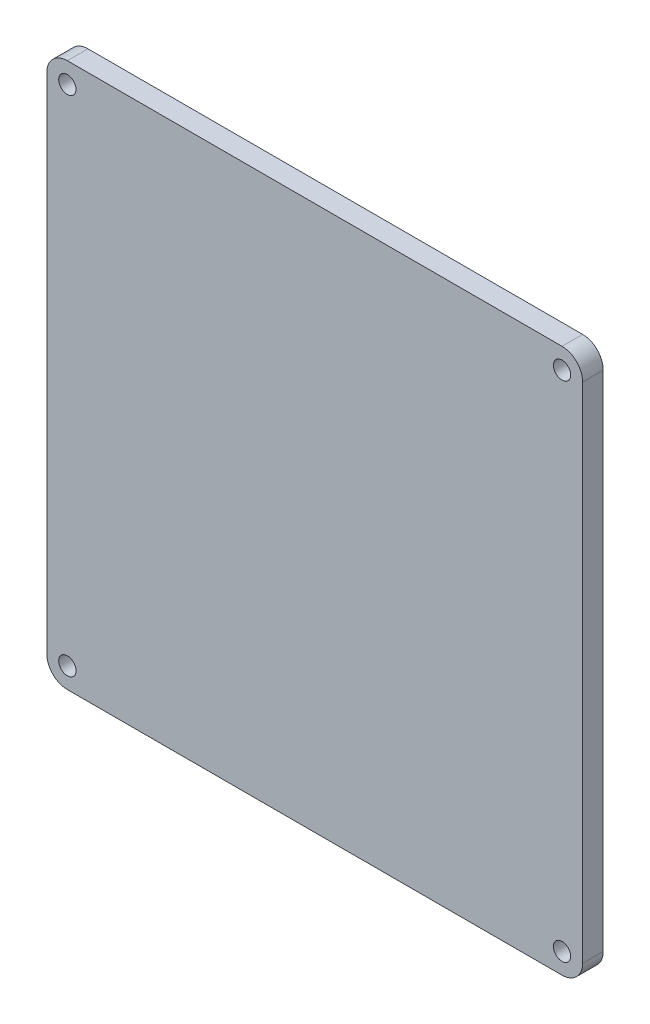
from build123d import *

# Parameters (mm, degrees)
SKETCH_1_W              = 260
SKETCH_1_H              = 264.25
EXTRUDE_1_DEPTH         = 10
FILLET_1_R              = 10
HOLE_WIZARD_8_4_8_4_1_D = 8.4


with BuildPart() as part:
    # 草图1 → 凸台-拉伸1 (new body)
    with BuildSketch(Plane.XY):
        Rectangle(SKETCH_1_W, SKETCH_1_H)
    extrude(amount=EXTRUDE_1_DEPTH)

    # 圆角1
    fillet_1_edges = [part.edges().sort_by_distance(p)[0] for p in [
        (130, -132.125, 5),
        (-130, -132.125, 5),
        (-130, 132.125, 5),
        (130, 132.125, 5),
    ]]
    fillet(fillet_1_edges, radius=FILLET_1_R)

    # Ø8.4 (8.4) 直径孔1 (through all)
    with Locations(Plane(origin=(0, 0, 0), x_dir=(1, 0, 0), z_dir=(0, 0, -1))):
        with Locations((-120, -122.125), (120, -122.125), (120, 122.125), (-120, 122.125)):
            Hole(HOLE_WIZARD_8_4_8_4_1_D / 2)


solid = part.part
